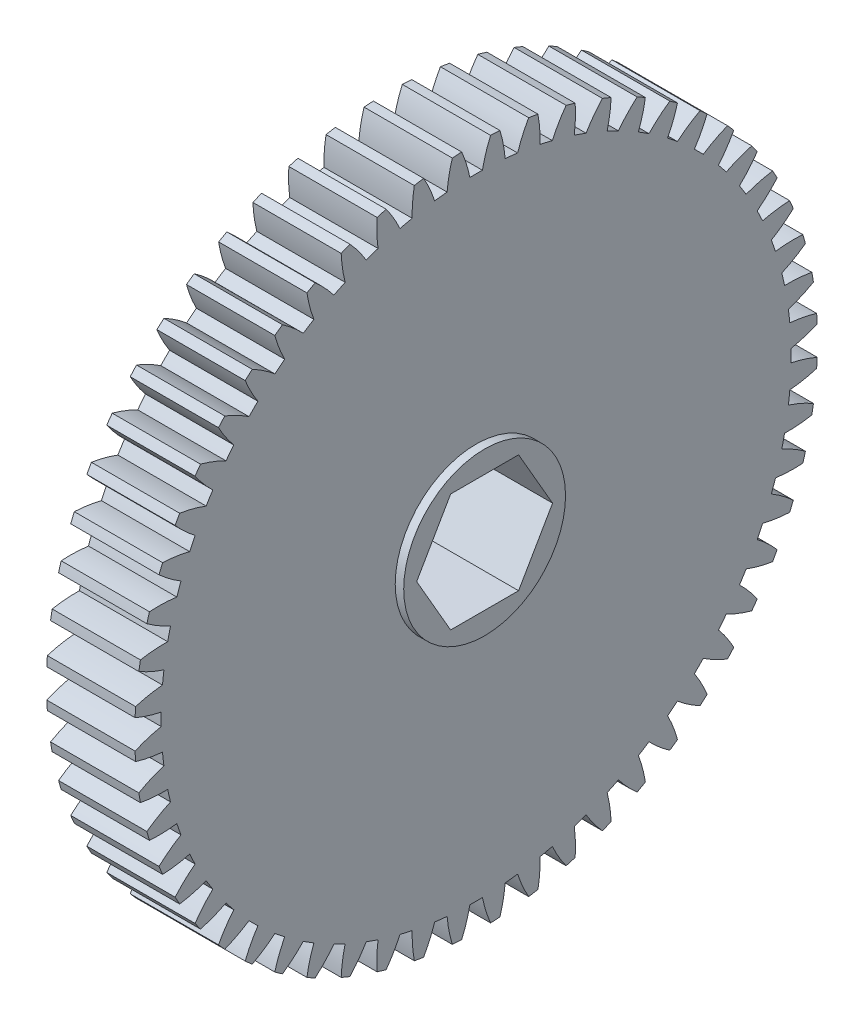
from build123d import *

# Parameters (mm, degrees)
SPUR_START             = -46.243156486
SPUR_GEAR_AI_OUTLINE_R = 6.35
SPUR_GEAR_AI_DEPTH     = 9.525
SKETCH1_R              = 8.73125
BOSS_EXTRUDE1_DEPTH    = 0.9144
CUT_EXTRUDE1_DEPTH     = 73.274579922


# Read off the part's stored shape, not the designer's step: spur gear_ai
with BuildPart() as part:
    # spur gear_ai outline → spur gear_ai (new body)
    with BuildSketch(Plane.YZ.offset(SPUR_START)):
        with BuildLine():
            ThreePointArc((44.092926079, 12.384423436), (44.181466106, 12.884619681), (44.263098997, 13.385989496))
            ThreePointArc((44.263098997, 13.385989496), (42.942953714, 14.051673519), (41.560840267, 14.576727044))
            ThreePointArc((41.560840267, 14.576727044), (41.64334469, 15.248738772), (41.712445503, 15.922260725))
            ThreePointArc((41.712445503, 15.922260725), (43.176741881, 16.126600886), (44.611916996, 16.48183486))
            ThreePointArc((44.611916996, 16.48183486), (44.643896091, 16.988799314), (44.668880083, 17.496156605))
            ThreePointArc((44.668880083, 17.496156605), (43.282502634, 18.009845571), (41.850292283, 18.376850061))
            ThreePointArc((41.850292283, 18.376850061), (41.857036494, 19.053873885), (41.850292283, 19.73089771))
            ThreePointArc((41.850292283, 19.73089771), (43.282502634, 20.0979022), (44.668880083, 20.611591167))
            ThreePointArc((44.668880083, 20.611591167), (44.643896091, 21.118948457), (44.611916996, 21.625912911))
            ThreePointArc((44.611916996, 21.625912911), (43.176741881, 21.981146885), (41.712445503, 22.185487046))
            ThreePointArc((41.712445503, 22.185487046), (41.64334469, 22.859008999), (41.560840267, 23.531020728))
            ThreePointArc((41.560840267, 23.531020728), (42.942953715, 24.056074252), (44.263098997, 24.721758275))
            ThreePointArc((44.263098997, 24.721758275), (44.181466106, 25.22312809), (44.092926079, 25.723324335))
            ThreePointArc((44.092926079, 25.723324335), (42.627001458, 25.915636042), (41.149033429, 25.954742178))
            ThreePointArc((41.149033429, 25.954742178), (41.004956575, 26.61629233), (40.847729482, 27.274841026))
            ThreePointArc((40.847729482, 27.274841026), (42.162365147, 27.951340732), (43.39967667, 28.760648448))
            ThreePointArc((43.39967667, 28.760648448), (43.262421461, 29.249725771), (43.118433945, 29.73686355))
            ThreePointArc((43.118433945, 29.73686355), (41.640194671, 29.763834559), (40.167141296, 29.637214888))
            ThreePointArc((40.167141296, 29.637214888), (39.949900251, 30.278473862), (39.719927709, 30.915277892))
            ThreePointArc((39.719927709, 30.915277892), (40.950553286, 31.734716404), (42.08947114, 32.6774703))
            ThreePointArc((42.08947114, 32.6774703), (41.898319677, 33.1481047), (41.700695397, 33.616057971))
            ThreePointArc((41.700695397, 33.616057971), (40.228731187, 33.477349106), (38.779116968, 33.186595944))
            ThreePointArc((38.779116968, 33.186595944), (38.491443664, 33.799499536), (38.191617711, 34.406550721))
            ThreePointArc((38.191617711, 34.406550721), (39.322757369, 35.358623124), (40.348959, 36.422967522))
            ThreePointArc((40.348959, 36.422967522), (40.106315123, 36.869240498), (39.857539321, 37.312124478))
            ThreePointArc((39.857539321, 37.312124478), (38.410360978, 37.009480084), (37.002415654, 36.55824982))
            ThreePointArc((37.002415654, 36.55824982), (36.64792775, 37.135090412), (36.282018872, 37.704754731))
            ThreePointArc((36.282018872, 37.704754731), (37.299447873, 38.777488161), (38.200028201, 39.950038313))
            ThreePointArc((38.200028201, 39.950038313), (37.908943298, 40.366337724), (37.612144473, 40.778582891))
            ThreePointArc((37.612144473, 40.778582891), (36.207951105, 40.315808896), (34.859380406, 39.709776012))
            ThreePointArc((34.859380406, 39.709776012), (34.442535792, 40.2432995), (34.015145505, 40.768413093))
            ThreePointArc((34.015145505, 40.768413093), (34.90606909, 41.948317306), (35.669702795, 43.214327713))
            ThreePointArc((35.669702795, 43.214327713), (35.333837427, 43.595418352), (34.992747996, 43.971840482))
            ThreePointArc((34.992747996, 43.971840482), (33.649198149, 43.354756538), (32.376961134, 42.601542251))
            ThreePointArc((32.376961134, 42.601542251), (31.903001874, 43.085039266), (31.419504859, 43.558998525))
            ThreePointArc((31.419504859, 43.558998525), (32.172719147, 44.83123554), (32.789803091, 46.174785387))
            ThreePointArc((32.789803091, 46.174785387), (32.41338096, 46.515874818), (32.032290321, 46.851740186))
            ThreePointArc((32.032290321, 46.851740186), (30.766279914, 46.088106482), (29.586375702, 45.197182897))
            ThreePointArc((29.586375702, 45.197182897), (29.061262108, 45.624573184), (28.527738621, 46.041417797))
            ThreePointArc((28.527738621, 46.041417797), (29.133771505, 47.389988496), (29.596545499, 48.794181864))
            ThreePointArc((29.596545499, 48.794181864), (29.184300332, 49.090980689), (28.768000922, 49.382065593))
            ThreePointArc((28.768000922, 49.382065593), (27.59545077, 48.481485265), (26.52271734, 47.464056263))
            ThreePointArc((26.52271734, 47.464056263), (25.953053021, 47.829965141), (25.376212428, 48.184453046))
            ThreePointArc((25.376212428, 48.184453046), (25.827442693, 49.592398369), (26.130087087, 51.039576712))
            ThreePointArc((26.130087087, 51.039576712), (25.687203106, 51.288352515), (25.24093013, 51.530996392))
            ThreePointArc((25.24093013, 51.530996392), (24.176585732, 50.50479476), (23.22451333, 49.373655102))
            ThreePointArc((23.22451333, 49.373655102), (22.617462145, 49.673481055), (22.004558552, 49.961154359))
            ThreePointArc((22.004558552, 49.961154359), (22.295311715, 51.410768578), (22.43402058, 52.882732788))
            ThreePointArc((22.43402058, 52.882732788), (21.966067308, 53.080357068), (21.495432908, 53.271508531))
            ThreePointArc((21.495432908, 53.271508531), (20.552679012, 52.132590678), (19.733240501, 50.9019651))
            ThreePointArc((19.733240501, 50.9019651), (19.09643647, 51.131937643), (18.455177496, 51.349178688))
            ThreePointArc((18.455177496, 51.349178688), (18.581797168, 52.822232062), (18.554826158, 54.300471336))
            ThreePointArc((18.554826158, 54.300471336), (18.06768838, 54.444458853), (17.578611057, 54.581714062))
            ThreePointArc((17.578611057, 54.581714062), (16.769303341, 53.344402538), (16.092803634, 52.029766873))
            ThreePointArc((16.092803634, 52.029766873), (15.434254939, 52.186993967), (14.772704787, 52.331070821))
            ThreePointArc((14.772704787, 52.331070821), (14.733598651, 53.80903885), (14.541286944, 55.27496347))
            ThreePointArc((14.541286944, 55.27496347), (14.041090699, 55.363503498), (13.539720884, 55.445136388))
            ThreePointArc((13.539720884, 55.445136388), (12.874036861, 54.124991106), (12.348983336, 52.742877658))
            ThreePointArc((12.348983336, 52.742877658), (11.676971607, 52.825382081), (11.003449654, 52.894482894))
            ThreePointArc((11.003449654, 52.894482894), (10.799109493, 54.358779272), (10.44387552, 55.793954387))
            ThreePointArc((10.44387552, 55.793954387), (9.936911066, 55.825933483), (9.429553775, 55.850917474))
            ThreePointArc((9.429553775, 55.850917474), (8.915864809, 54.464540025), (8.548860319, 53.032329674))
            ThreePointArc((8.548860319, 53.032329674), (7.871836494, 53.039073886), (7.19481267, 53.032329674))
            ThreePointArc((7.19481267, 53.032329674), (6.82780818, 54.464540025), (6.314119213, 55.850917474))
            ThreePointArc((6.314119213, 55.850917474), (5.806761922, 55.825933483), (5.299797468, 55.793954387))
            ThreePointArc((5.299797468, 55.793954387), (4.944563495, 54.358779272), (4.740223334, 52.894482894))
            ThreePointArc((4.740223334, 52.894482894), (4.066701381, 52.825382081), (3.394689652, 52.742877658))
            ThreePointArc((3.394689652, 52.742877658), (2.869636128, 54.124991106), (2.203952105, 55.445136388))
            ThreePointArc((2.203952105, 55.445136388), (1.70258229, 55.363503498), (1.202386045, 55.27496347))
            ThreePointArc((1.202386045, 55.27496347), (1.010074338, 53.80903885), (0.970968202, 52.331070821))
            ThreePointArc((0.970968202, 52.331070821), (0.30941805, 52.186993967), (-0.349130646, 52.029766873))
            ThreePointArc((-0.349130646, 52.029766873), (-1.025630352, 53.344402539), (-1.834938069, 54.581714062))
            ThreePointArc((-1.834938069, 54.581714062), (-2.324015392, 54.444458853), (-2.81115317, 54.300471336))
            ThreePointArc((-2.81115317, 54.300471336), (-2.838124179, 52.822232062), (-2.711504508, 51.349178688))
            ThreePointArc((-2.711504508, 51.349178688), (-3.352763482, 51.131937643), (-3.989567513, 50.9019651))
            ThreePointArc((-3.989567513, 50.9019651), (-4.809006024, 52.132590678), (-5.75175992, 53.271508531))
            ThreePointArc((-5.75175992, 53.271508531), (-6.22239432, 53.080357068), (-6.690347591, 52.882732788))
            ThreePointArc((-6.690347591, 52.882732788), (-6.551638727, 51.410768578), (-6.260885564, 49.961154359))
            ThreePointArc((-6.260885564, 49.961154359), (-6.873789157, 49.673481055), (-7.480840342, 49.373655102))
            ThreePointArc((-7.480840342, 49.373655102), (-8.432912744, 50.50479476), (-9.497257142, 51.530996392))
            ThreePointArc((-9.497257142, 51.530996392), (-9.943530118, 51.288352515), (-10.386414099, 51.039576712))
            ThreePointArc((-10.386414099, 51.039576712), (-10.083769704, 49.592398369), (-9.63253944, 48.184453046))
            ThreePointArc((-9.63253944, 48.184453046), (-10.209380033, 47.829965141), (-10.779044352, 47.464056263))
            ThreePointArc((-10.779044352, 47.464056263), (-11.851777781, 48.481485265), (-13.024327933, 49.382065593))
            ThreePointArc((-13.024327933, 49.382065593), (-13.440627344, 49.090980689), (-13.852872511, 48.794181864))
            ThreePointArc((-13.852872511, 48.794181864), (-13.390098516, 47.389988496), (-12.784065632, 46.041417797))
            ThreePointArc((-12.784065632, 46.041417797), (-13.31758912, 45.624573184), (-13.842702713, 45.197182897))
            ThreePointArc((-13.842702713, 45.197182897), (-15.022606926, 46.088106482), (-16.288617333, 46.851740186))
            ThreePointArc((-16.288617333, 46.851740186), (-16.669707972, 46.515874818), (-17.046130102, 46.174785387))
            ThreePointArc((-17.046130102, 46.174785387), (-16.429046159, 44.83123554), (-15.675831871, 43.558998525))
            ThreePointArc((-15.675831871, 43.558998525), (-16.159328886, 43.085039266), (-16.633288146, 42.601542251))
            ThreePointArc((-16.633288146, 42.601542251), (-17.905525161, 43.354756538), (-19.249075008, 43.971840482))
            ThreePointArc((-19.249075008, 43.971840482), (-19.590164438, 43.595418352), (-19.926029806, 43.214327713))
            ThreePointArc((-19.926029806, 43.214327713), (-19.162396102, 41.948317306), (-18.271472517, 40.768413093))
            ThreePointArc((-18.271472517, 40.768413093), (-18.698862804, 40.2432995), (-19.115707417, 39.709776012))
            ThreePointArc((-19.115707417, 39.709776012), (-20.464278116, 40.315808896), (-21.868471484, 40.778582891))
            ThreePointArc((-21.868471484, 40.778582891), (-22.16527031, 40.366337724), (-22.456355213, 39.950038313))
            ThreePointArc((-22.456355213, 39.950038313), (-21.555774885, 38.777488161), (-20.538345883, 37.704754731))
            ThreePointArc((-20.538345883, 37.704754731), (-20.904254761, 37.135090412), (-21.258742666, 36.55824982))
            ThreePointArc((-21.258742666, 36.55824982), (-22.666687989, 37.009480084), (-24.113866332, 37.312124478))
            ThreePointArc((-24.113866332, 37.312124478), (-24.362642135, 36.869240498), (-24.605286012, 36.422967522))
            ThreePointArc((-24.605286012, 36.422967522), (-23.579084381, 35.358623124), (-22.447944722, 34.406550721))
            ThreePointArc((-22.447944722, 34.406550721), (-22.747770675, 33.799499536), (-23.035443979, 33.186595944))
            ThreePointArc((-23.035443979, 33.186595944), (-24.485058198, 33.477349106), (-25.957022409, 33.616057971))
            ThreePointArc((-25.957022409, 33.616057971), (-26.154646688, 33.1481047), (-26.345798151, 32.6774703))
            ThreePointArc((-26.345798151, 32.6774703), (-25.206880298, 31.734716404), (-23.976254721, 30.915277892))
            ThreePointArc((-23.976254721, 30.915277892), (-24.206227263, 30.278473862), (-24.423468308, 29.637214888))
            ThreePointArc((-24.423468308, 29.637214888), (-25.896521682, 29.763834559), (-27.374760956, 29.73686355))
            ThreePointArc((-27.374760956, 29.73686355), (-27.518748473, 29.249725771), (-27.656003682, 28.760648448))
            ThreePointArc((-27.656003682, 28.760648448), (-26.418692159, 27.951340732), (-25.104056493, 27.274841026))
            ThreePointArc((-25.104056493, 27.274841026), (-25.261283587, 26.61629233), (-25.405360441, 25.954742178))
            ThreePointArc((-25.405360441, 25.954742178), (-26.88332847, 25.915636042), (-28.34925309, 25.723324335))
            ThreePointArc((-28.34925309, 25.723324335), (-28.437793118, 25.22312809), (-28.519426009, 24.721758275))
            ThreePointArc((-28.519426009, 24.721758275), (-27.199280726, 24.056074252), (-25.817167278, 23.531020728))
            ThreePointArc((-25.817167278, 23.531020728), (-25.899671701, 22.859008999), (-25.968772514, 22.185487046))
            ThreePointArc((-25.968772514, 22.185487046), (-27.433068893, 21.981146885), (-28.868244007, 21.625912911))
            ThreePointArc((-28.868244007, 21.625912911), (-28.900223103, 21.118948457), (-28.925207095, 20.611591167))
            ThreePointArc((-28.925207095, 20.611591167), (-27.538829646, 20.0979022), (-26.106619294, 19.73089771))
            ThreePointArc((-26.106619294, 19.73089771), (-26.113363506, 19.053873885), (-26.106619294, 18.376850061))
            ThreePointArc((-26.106619294, 18.376850061), (-27.538829645, 18.009845571), (-28.925207095, 17.496156605))
            ThreePointArc((-28.925207095, 17.496156605), (-28.900223103, 16.988799314), (-28.868244007, 16.48183486))
            ThreePointArc((-28.868244007, 16.48183486), (-27.433068893, 16.126600886), (-25.968772514, 15.922260725))
            ThreePointArc((-25.968772514, 15.922260725), (-25.899671701, 15.248738772), (-25.817167278, 14.576727044))
            ThreePointArc((-25.817167278, 14.576727044), (-27.199280726, 14.051673519), (-28.519426009, 13.385989496))
            ThreePointArc((-28.519426009, 13.385989496), (-28.437793118, 12.884619681), (-28.34925309, 12.384423436))
            ThreePointArc((-28.34925309, 12.384423436), (-26.88332847, 12.192111729), (-25.405360441, 12.153005593))
            ThreePointArc((-25.405360441, 12.153005593), (-25.261283587, 11.491455441), (-25.104056493, 10.832906745))
            ThreePointArc((-25.104056493, 10.832906745), (-26.418692159, 10.156407039), (-27.656003682, 9.347099323))
            ThreePointArc((-27.656003682, 9.347099323), (-27.518748473, 8.858022), (-27.374760956, 8.370884221))
            ThreePointArc((-27.374760956, 8.370884221), (-25.896521682, 8.343913212), (-24.423468308, 8.470532883))
            ThreePointArc((-24.423468308, 8.470532883), (-24.206227263, 7.829273909), (-23.976254721, 7.192469879))
            ThreePointArc((-23.976254721, 7.192469879), (-25.206880298, 6.373031367), (-26.345798151, 5.430277471))
            ThreePointArc((-26.345798151, 5.430277471), (-26.154646688, 4.959643072), (-25.957022409, 4.4916898))
            ThreePointArc((-25.957022409, 4.4916898), (-24.485058198, 4.630398665), (-23.035443979, 4.921151827))
            ThreePointArc((-23.035443979, 4.921151827), (-22.747770675, 4.308248235), (-22.447944722, 3.70119705))
            ThreePointArc((-22.447944722, 3.70119705), (-23.579084381, 2.749124648), (-24.605286012, 1.68478025))
            ThreePointArc((-24.605286012, 1.68478025), (-24.362642135, 1.238507274), (-24.113866332, 0.795623293))
            ThreePointArc((-24.113866332, 0.795623293), (-22.666687989, 1.098267687), (-21.258742666, 1.549497951))
            ThreePointArc((-21.258742666, 1.549497951), (-20.904254761, 0.972657359), (-20.538345883, 0.40299304))
            ThreePointArc((-20.538345883, 0.40299304), (-21.555774885, -0.66974039), (-22.456355213, -1.842290542))
            ThreePointArc((-22.456355213, -1.842290542), (-22.16527031, -2.258589953), (-21.868471484, -2.670835119))
            ThreePointArc((-21.868471484, -2.670835119), (-20.464278116, -2.208061125), (-19.115707417, -1.602028241))
            ThreePointArc((-19.115707417, -1.602028241), (-18.698862804, -2.135551728), (-18.271472517, -2.660665322))
            ThreePointArc((-18.271472517, -2.660665322), (-19.162396102, -3.840569534), (-19.926029806, -5.106579942))
            ThreePointArc((-19.926029806, -5.106579942), (-19.590164438, -5.48767058), (-19.249075008, -5.864092711))
            ThreePointArc((-19.249075008, -5.864092711), (-17.905525161, -5.247008767), (-16.633288146, -4.493794479))
            ThreePointArc((-16.633288146, -4.493794479), (-16.159328886, -4.977291494), (-15.675831871, -5.451250754))
            ThreePointArc((-15.675831871, -5.451250754), (-16.429046159, -6.723487769), (-17.046130102, -8.067037616))
            ThreePointArc((-17.046130102, -8.067037616), (-16.669707972, -8.408127047), (-16.288617333, -8.743992415))
            ThreePointArc((-16.288617333, -8.743992415), (-15.022606926, -7.980358711), (-13.842702713, -7.089435125))
            ThreePointArc((-13.842702713, -7.089435125), (-13.31758912, -7.516825412), (-12.784065632, -7.933670026))
            ThreePointArc((-12.784065632, -7.933670026), (-13.390098516, -9.282240725), (-13.852872511, -10.686434093))
            ThreePointArc((-13.852872511, -10.686434093), (-13.440627344, -10.983232918), (-13.024327933, -11.274317821))
            ThreePointArc((-13.024327933, -11.274317821), (-11.851777781, -10.373737494), (-10.779044352, -9.356308492))
            ThreePointArc((-10.779044352, -9.356308492), (-10.209380033, -9.72221737), (-9.63253944, -10.076705274))
            ThreePointArc((-9.63253944, -10.076705274), (-10.083769704, -11.484650598), (-10.386414099, -12.931828941))
            ThreePointArc((-10.386414099, -12.931828941), (-9.943530118, -13.180604743), (-9.497257142, -13.42324862))
            ThreePointArc((-9.497257142, -13.42324862), (-8.432912744, -12.397046989), (-7.480840342, -11.265907331))
            ThreePointArc((-7.480840342, -11.265907331), (-6.873789157, -11.565733284), (-6.260885564, -11.853406588))
            ThreePointArc((-6.260885564, -11.853406588), (-6.551638727, -13.303020807), (-6.690347591, -14.774985017))
            ThreePointArc((-6.690347591, -14.774985017), (-6.22239432, -14.972609297), (-5.75175992, -15.16376076))
            ThreePointArc((-5.75175992, -15.16376076), (-4.809006024, -14.024842906), (-3.989567513, -12.794217329))
            ThreePointArc((-3.989567513, -12.794217329), (-3.352763482, -13.024189872), (-2.711504508, -13.241430917))
            ThreePointArc((-2.711504508, -13.241430917), (-2.838124179, -14.714484291), (-2.81115317, -16.192723565))
            ThreePointArc((-2.81115317, -16.192723565), (-2.324015392, -16.336711082), (-1.834938069, -16.473966291))
            ThreePointArc((-1.834938069, -16.473966291), (-1.025630352, -15.236654768), (-0.349130646, -13.922019102))
            ThreePointArc((-0.349130646, -13.922019102), (0.30941805, -14.079246195), (0.970968202, -14.223323049))
            ThreePointArc((0.970968202, -14.223323049), (1.010074338, -15.701291078), (1.202386045, -17.167215699))
            ThreePointArc((1.202386045, -17.167215699), (1.70258229, -17.255755726), (2.203952105, -17.337388617))
            ThreePointArc((2.203952105, -17.337388617), (2.869636128, -16.017243335), (3.394689652, -14.635129887))
            ThreePointArc((3.394689652, -14.635129887), (4.066701381, -14.71763431), (4.740223334, -14.786735123))
            ThreePointArc((4.740223334, -14.786735123), (4.944563495, -16.251031501), (5.299797468, -17.686206616))
            ThreePointArc((5.299797468, -17.686206616), (5.806761922, -17.718185711), (6.314119213, -17.743169703))
            ThreePointArc((6.314119213, -17.743169703), (6.82780818, -16.356792254), (7.19481267, -14.924581903))
            ThreePointArc((7.19481267, -14.924581903), (7.871836495, -14.931326114), (8.548860319, -14.924581903))
            ThreePointArc((8.548860319, -14.924581903), (8.915864809, -16.356792254), (9.429553775, -17.743169703))
            ThreePointArc((9.429553775, -17.743169703), (9.936911066, -17.718185711), (10.44387552, -17.686206616))
            ThreePointArc((10.44387552, -17.686206616), (10.799109493, -16.251031501), (11.003449654, -14.786735123))
            ThreePointArc((11.003449654, -14.786735123), (11.676971607, -14.71763431), (12.348983336, -14.635129887))
            ThreePointArc((12.348983336, -14.635129887), (12.874036861, -16.017243335), (13.539720884, -17.337388617))
            ThreePointArc((13.539720884, -17.337388617), (14.041090699, -17.255755726), (14.541286944, -17.167215699))
            ThreePointArc((14.541286944, -17.167215699), (14.733598651, -15.701291078), (14.772704787, -14.223323049))
            ThreePointArc((14.772704787, -14.223323049), (15.434254939, -14.079246195), (16.092803634, -13.922019102))
            ThreePointArc((16.092803634, -13.922019102), (16.769303341, -15.236654767), (17.578611057, -16.473966291))
            ThreePointArc((17.578611057, -16.473966291), (18.06768838, -16.336711082), (18.554826158, -16.192723565))
            ThreePointArc((18.554826158, -16.192723565), (18.581797168, -14.714484291), (18.455177496, -13.241430917))
            ThreePointArc((18.455177496, -13.241430917), (19.09643647, -13.024189872), (19.733240501, -12.794217329))
            ThreePointArc((19.733240501, -12.794217329), (20.552679012, -14.024842906), (21.495432908, -15.16376076))
            ThreePointArc((21.495432908, -15.16376076), (21.966067308, -14.972609297), (22.43402058, -14.774985017))
            ThreePointArc((22.43402058, -14.774985017), (22.295311715, -13.303020807), (22.004558552, -11.853406588))
            ThreePointArc((22.004558552, -11.853406588), (22.617462145, -11.565733284), (23.22451333, -11.265907331))
            ThreePointArc((23.22451333, -11.265907331), (24.176585732, -12.397046989), (25.24093013, -13.42324862))
            ThreePointArc((25.24093013, -13.42324862), (25.687203106, -13.180604743), (26.130087087, -12.931828941))
            ThreePointArc((26.130087087, -12.931828941), (25.827442693, -11.484650598), (25.376212428, -10.076705274))
            ThreePointArc((25.376212428, -10.076705274), (25.953053021, -9.72221737), (26.52271734, -9.356308492))
            ThreePointArc((26.52271734, -9.356308492), (27.59545077, -10.373737494), (28.768000922, -11.274317821))
            ThreePointArc((28.768000922, -11.274317821), (29.184300332, -10.983232918), (29.596545499, -10.686434093))
            ThreePointArc((29.596545499, -10.686434093), (29.133771505, -9.282240725), (28.527738621, -7.933670026))
            ThreePointArc((28.527738621, -7.933670026), (29.061262108, -7.516825412), (29.586375702, -7.089435125))
            ThreePointArc((29.586375702, -7.089435125), (30.766279914, -7.980358711), (32.032290321, -8.743992415))
            ThreePointArc((32.032290321, -8.743992415), (32.41338096, -8.408127047), (32.789803091, -8.067037616))
            ThreePointArc((32.789803091, -8.067037616), (32.172719147, -6.723487769), (31.419504859, -5.451250754))
            ThreePointArc((31.419504859, -5.451250754), (31.903001874, -4.977291494), (32.376961134, -4.493794479))
            ThreePointArc((32.376961134, -4.493794479), (33.649198149, -5.247008767), (34.992747996, -5.864092711))
            ThreePointArc((34.992747996, -5.864092711), (35.333837427, -5.48767058), (35.669702795, -5.106579942))
            ThreePointArc((35.669702795, -5.106579942), (34.90606909, -3.840569535), (34.015145505, -2.660665322))
            ThreePointArc((34.015145505, -2.660665322), (34.442535792, -2.135551728), (34.859380406, -1.602028241))
            ThreePointArc((34.859380406, -1.602028241), (36.207951104, -2.208061125), (37.612144473, -2.670835119))
            ThreePointArc((37.612144473, -2.670835119), (37.908943298, -2.258589953), (38.200028201, -1.842290542))
            ThreePointArc((38.200028201, -1.842290542), (37.299447873, -0.66974039), (36.282018872, 0.40299304))
            ThreePointArc((36.282018872, 0.40299304), (36.64792775, 0.972657359), (37.002415654, 1.549497951))
            ThreePointArc((37.002415654, 1.549497951), (38.410360978, 1.098267687), (39.857539321, 0.795623293))
            ThreePointArc((39.857539321, 0.795623293), (40.106315123, 1.238507274), (40.348959, 1.68478025))
            ThreePointArc((40.348959, 1.68478025), (39.322757369, 2.749124648), (38.191617711, 3.70119705))
            ThreePointArc((38.191617711, 3.70119705), (38.491443664, 4.308248235), (38.779116968, 4.921151827))
            ThreePointArc((38.779116968, 4.921151827), (40.228731187, 4.630398665), (41.700695397, 4.4916898))
            ThreePointArc((41.700695397, 4.4916898), (41.898319677, 4.959643071), (42.08947114, 5.430277471))
            ThreePointArc((42.08947114, 5.430277471), (40.950553286, 6.373031367), (39.719927709, 7.192469879))
            ThreePointArc((39.719927709, 7.192469879), (39.949900251, 7.829273909), (40.167141296, 8.470532883))
            ThreePointArc((40.167141296, 8.470532883), (41.640194671, 8.343913212), (43.118433945, 8.370884221))
            ThreePointArc((43.118433945, 8.370884221), (43.262421461, 8.858022), (43.39967667, 9.347099323))
            ThreePointArc((43.39967667, 9.347099323), (42.162365147, 10.156407039), (40.847729482, 10.832906745))
            ThreePointArc((40.847729482, 10.832906745), (41.004956575, 11.491455441), (41.149033429, 12.153005593))
            ThreePointArc((41.149033429, 12.153005593), (42.627001458, 12.192111729), (44.092926079, 12.384423436))
        make_face()
        with Locations((7.871836494, 19.053873886)):
            Circle(SPUR_GEAR_AI_OUTLINE_R, mode=Mode.SUBTRACT)
    extrude(amount=SPUR_GEAR_AI_DEPTH)

    # Sketch1 → Boss-Extrude1 (add)
    with BuildSketch(Plane(origin=(-36.718156486, 0, 0), x_dir=(0, 0, -1), z_dir=(1, 0, 0))):
        with Locations(Location((-19.053873886, 7.871836494, 0), (0, 0, 180))):
            Circle(SKETCH1_R)
    extrude(amount=BOSS_EXTRUDE1_DEPTH)

    # Sketch2 → Cut-Extrude1 (cut, through all)
    with BuildSketch(Plane(origin=(-35.803756486, 0, 0), x_dir=(0, 0, -1), z_dir=(1, 0, 0))):
        Polygon((-15.387699676, 14.221836494), (-22.720048095, 14.221836494), (-26.386222304, 7.871836494), (-22.720048095, 1.521836494), (-15.387699676, 1.521836494), (-11.721525467, 7.871836494), align=None)
    extrude(amount=-CUT_EXTRUDE1_DEPTH, mode=Mode.SUBTRACT)


solid = part.part
